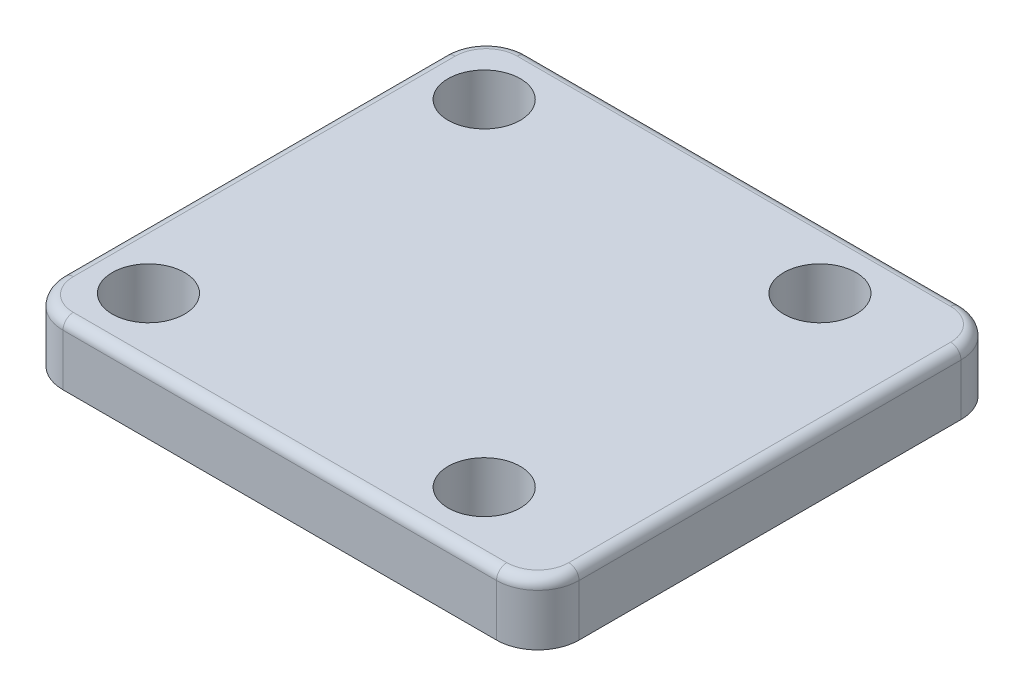
from build123d import *

# Parameters (mm, degrees)
BOSS_EXTRUDE1_DEPTH = 6
FILLET1_R           = 1
SKETCH2_R           = 16
BOSS_EXTRUDE2_DEPTH = 2
CHAMFER1_SIZE       = 1
SKETCH3_R           = 3.5
CUT_EXTRUDE1_DEPTH  = 37.568112016


with BuildPart() as part:
    # Sketch1 → Boss-Extrude1 (new body)
    with BuildSketch(Plane(origin=(0, 0, 0), x_dir=(1, 0, 0), z_dir=(0, 1, 0))):
        with BuildLine():
            Line((-18.30565371, 22.5), (23.69434629, 22.5))
            ThreePointArc((23.69434629, 22.5), (26.522773414, 21.328427125), (27.69434629, 18.5))
            Line((27.69434629, 18.5), (27.69434629, -18.5))
            ThreePointArc((27.69434629, -18.5), (26.522773414, -21.328427125), (23.69434629, -22.5))
            Line((23.69434629, -22.5), (-18.30565371, -22.5))
            ThreePointArc((-18.30565371, -22.5), (-21.134080835, -21.328427125), (-22.30565371, -18.5))
            Line((-22.30565371, -18.5), (-22.30565371, 18.5))
            ThreePointArc((-22.30565371, 18.5), (-21.134080835, 21.328427125), (-18.30565371, 22.5))
        make_face()
    extrude(amount=BOSS_EXTRUDE1_DEPTH)

    # Fillet1
    fillet1_edges = [part.edges().sort_by_distance(p)[0] for p in [
        (27.69434629, 6, 0),
        (26.522773414, 6, 21.328427125),
        (2.69434629, 6, 22.5),
        (-21.134080835, 6, 21.328427125),
        (-22.30565371, 6, 0),
        (-21.134080835, 6, -21.328427125),
        (2.69434629, 6, -22.5),
        (26.522773414, 6, -21.328427125),
    ]]
    fillet(fillet1_edges, radius=FILLET1_R)

    # Sketch2 → Boss-Extrude2 (add)
    with BuildSketch(Plane.XZ):
        Circle(SKETCH2_R)
    extrude(amount=BOSS_EXTRUDE2_DEPTH)

    # Chamfer1
    chamfer1_edges = [part.edges().sort_by_distance(p)[0] for p in [
        (-16, -2, 0),
    ]]
    chamfer(chamfer1_edges, length=CHAMFER1_SIZE)

    # Sketch3 → Cut-Extrude1 (cut, through all)
    with BuildSketch(Plane(origin=(0, 6, 0), x_dir=(1, 0, 0), z_dir=(0, 1, 0))):
        with Locations((-16.263455967, 16.263455967)):
            Circle(SKETCH3_R)
        with Locations((16.263455967, 16.263455967)):
            Circle(SKETCH3_R)
        with Locations((16.263455967, -16.263455967)):
            Circle(SKETCH3_R)
        with Locations((-16.263455967, -16.263455967)):
            Circle(SKETCH3_R)
    extrude(amount=-CUT_EXTRUDE1_DEPTH, mode=Mode.SUBTRACT)


solid = part.part
